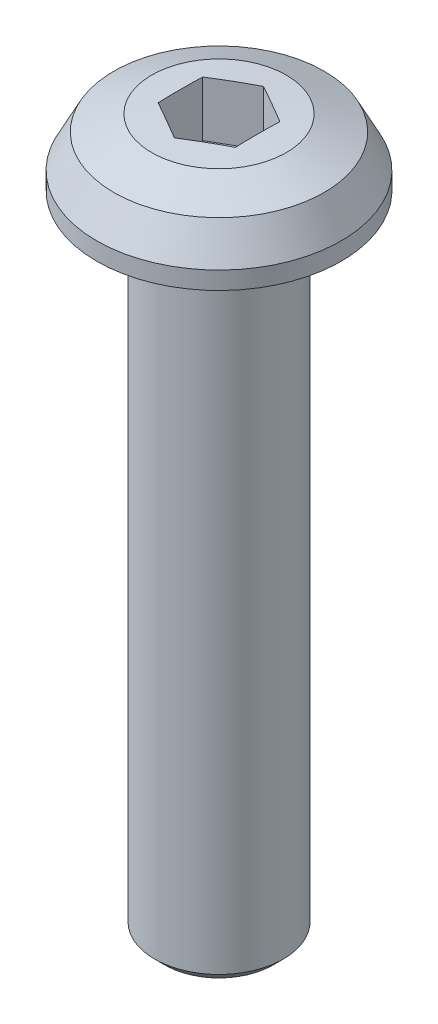
from build123d import *

# Parameters (mm, degrees)
CUT_EXTRUDE1_DEPTH = 2.25


with BuildPart() as part:
    # Sketch1 → Revolve1 (revolve)
    with BuildSketch(Plane.XY):
        Polygon((0, -25), (2.1, -25), (2.5, -24.6), (2.5, 0), (4.75, 0), (4.75, 0.6875), (4.085, 1.98), (2.6125, 2.585), (0, 2.75), align=None)
    revolve(axis=Axis((0, -10, 0), (0, 1, 0)))

    # Sketch2 → Cut-Extrude1 (cut)
    with BuildSketch(Plane(origin=(0, 2.75, 0), x_dir=(1, 0, 0), z_dir=(0, 1, 0))):
        Polygon((1.5, -0.866025404), (0, -1.732050808), (-1.5, -0.866025404), (-1.5, 0.866025404), (0, 1.732050808), (1.5, 0.866025404), align=None)
    extrude(amount=-CUT_EXTRUDE1_DEPTH, mode=Mode.SUBTRACT)


solid = part.part
